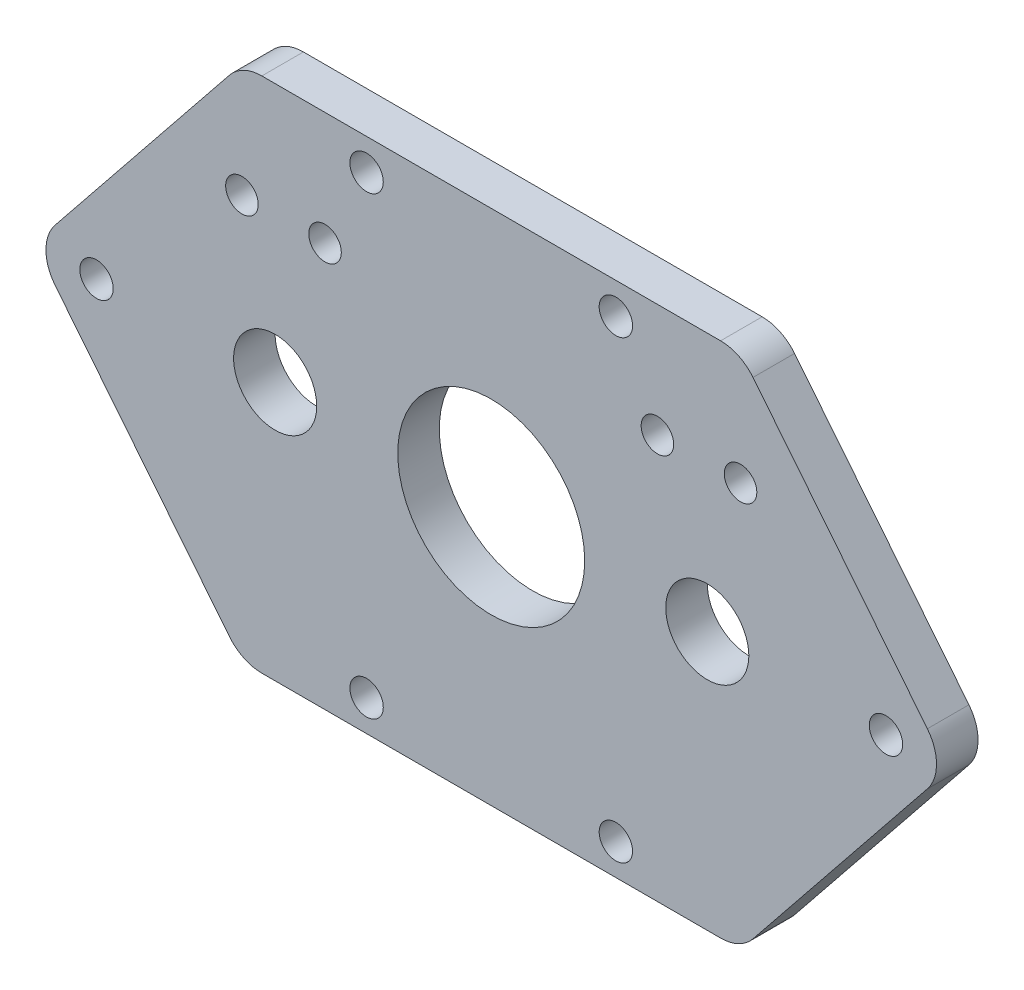
from build123d import *

# Parameters (mm, degrees)
SKETCH5_R           = 2.5527
SKETCH5_R_2         = 6.35
SKETCH5_R_3         = 2.4892
SKETCH5_R_4         = 14.2875
BOSS_EXTRUDE1_DEPTH = 6.35
FILLET2_R           = 6.35


with BuildPart() as part:
    # Sketch5 → Boss-Extrude1 (new body)
    with BuildSketch(Plane.XY):
        Polygon((-69.85, 0), (-38.1, -39.52494), (38.1, -39.52494), (69.85, 0), (38.1, 39.52494), (-38.1, 39.52494), align=None)
        with Locations((-19.05, -34.76244)):
            Circle(SKETCH5_R, mode=Mode.SUBTRACT)
        with Locations((19.05, -34.76244)):
            Circle(SKETCH5_R, mode=Mode.SUBTRACT)
        with Locations((-60.325, 0)):
            Circle(SKETCH5_R, mode=Mode.SUBTRACT)
        with Locations((-33.02, 0)):
            Circle(SKETCH5_R_2, mode=Mode.SUBTRACT)
        with Locations((-38.1, 22.225)):
            Circle(SKETCH5_R_3, mode=Mode.SUBTRACT)
        with Locations((-25.4, 22.225)):
            Circle(SKETCH5_R_3, mode=Mode.SUBTRACT)
        with Locations((-19.05, 34.76244)):
            Circle(SKETCH5_R, mode=Mode.SUBTRACT)
        Circle(SKETCH5_R_4, mode=Mode.SUBTRACT)
        with Locations((33.02, 0)):
            Circle(SKETCH5_R_2, mode=Mode.SUBTRACT)
        with Locations((60.325, 0)):
            Circle(SKETCH5_R, mode=Mode.SUBTRACT)
        with Locations((25.4, 22.225)):
            Circle(SKETCH5_R_3, mode=Mode.SUBTRACT)
        with Locations((19.05, 34.76244)):
            Circle(SKETCH5_R, mode=Mode.SUBTRACT)
        with Locations((38.1, 22.225)):
            Circle(SKETCH5_R_3, mode=Mode.SUBTRACT)
    extrude(amount=BOSS_EXTRUDE1_DEPTH)

    # Fillet2
    fillet2_edges = [part.edges().sort_by_distance(p)[0] for p in [
        (38.1, -39.52494, 3.175),
        (-38.1, -39.52494, 3.175),
        (38.1, 39.52494, 3.175),
        (-38.1, 39.52494, 3.175),
        (69.85, 0, 3.175),
        (-69.85, 0, 3.175),
    ]]
    fillet(fillet2_edges, radius=FILLET2_R)


solid = part.part
